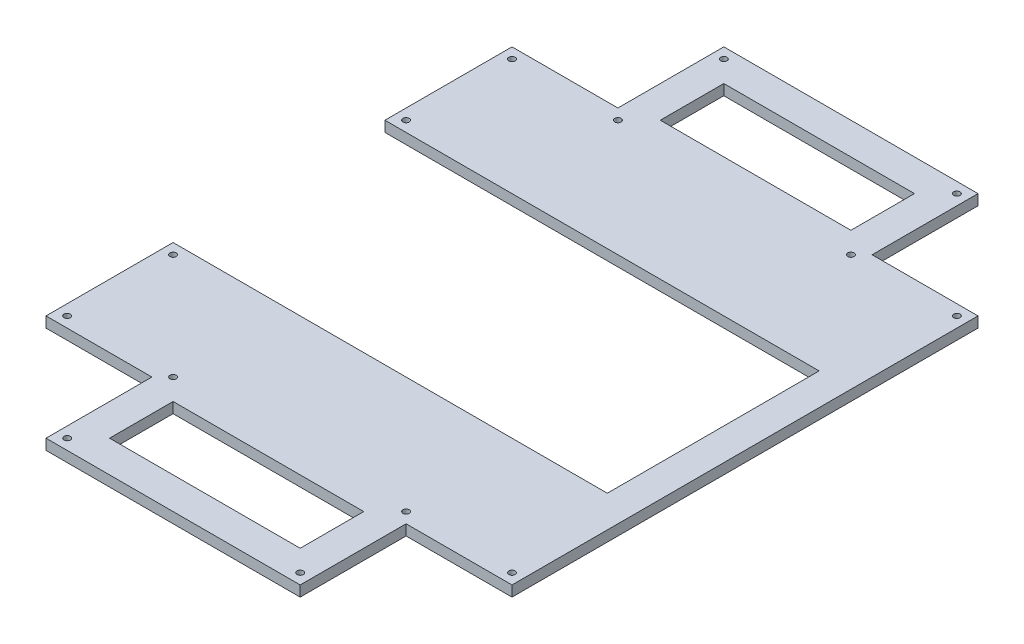
from build123d import *

# Parameters (mm, degrees)
ESQUISSE1_R        = 1.5
ESQUISSE1_W        = 90
ESQUISSE1_H        = 30
BOSS_EXTRU_1_DEPTH = 5


with BuildPart() as part:
    # Esquisse1 → Boss.-Extru.1 (new body)
    with BuildSketch(Plane(origin=(0, 0, 0), x_dir=(1, 0, 0), z_dir=(0, 1, 0))):
        Polygon((-60, 110), (-60, 160), (60, 160), (60, 110), (110, 110), (110, -110), (60, -110), (60, -160), (-60, -160), (-60, -110), (-110, -110), (-110, -50), (95, -50), (95, 50), (-110, 50), (-110, 110), align=None)
        with Locations((-105, -105)):
            Circle(ESQUISSE1_R, mode=Mode.SUBTRACT)
        with Locations((-105, -55)):
            Circle(ESQUISSE1_R, mode=Mode.SUBTRACT)
        with Locations((-55, -105)):
            Circle(ESQUISSE1_R, mode=Mode.SUBTRACT)
        with Locations((-55, -155)):
            Circle(ESQUISSE1_R, mode=Mode.SUBTRACT)
        with Locations((-55, 155)):
            Circle(ESQUISSE1_R, mode=Mode.SUBTRACT)
        with Locations((-55, 105)):
            Circle(ESQUISSE1_R, mode=Mode.SUBTRACT)
        with Locations((-105, 105)):
            Circle(ESQUISSE1_R, mode=Mode.SUBTRACT)
        with Locations((-105, 55)):
            Circle(ESQUISSE1_R, mode=Mode.SUBTRACT)
        with Locations((55, -155)):
            Circle(ESQUISSE1_R, mode=Mode.SUBTRACT)
        with Locations((55, -105)):
            Circle(ESQUISSE1_R, mode=Mode.SUBTRACT)
        with Locations((105, -105)):
            Circle(ESQUISSE1_R, mode=Mode.SUBTRACT)
        with Locations((105, 105)):
            Circle(ESQUISSE1_R, mode=Mode.SUBTRACT)
        with Locations((55, 105)):
            Circle(ESQUISSE1_R, mode=Mode.SUBTRACT)
        with Locations((55, 155)):
            Circle(ESQUISSE1_R, mode=Mode.SUBTRACT)
        with Locations((0, -130)):
            Rectangle(ESQUISSE1_W, ESQUISSE1_H, mode=Mode.SUBTRACT)
        with Locations((0, 130)):
            Rectangle(ESQUISSE1_W, ESQUISSE1_H, mode=Mode.SUBTRACT)
    extrude(amount=BOSS_EXTRU_1_DEPTH)


solid = part.part
